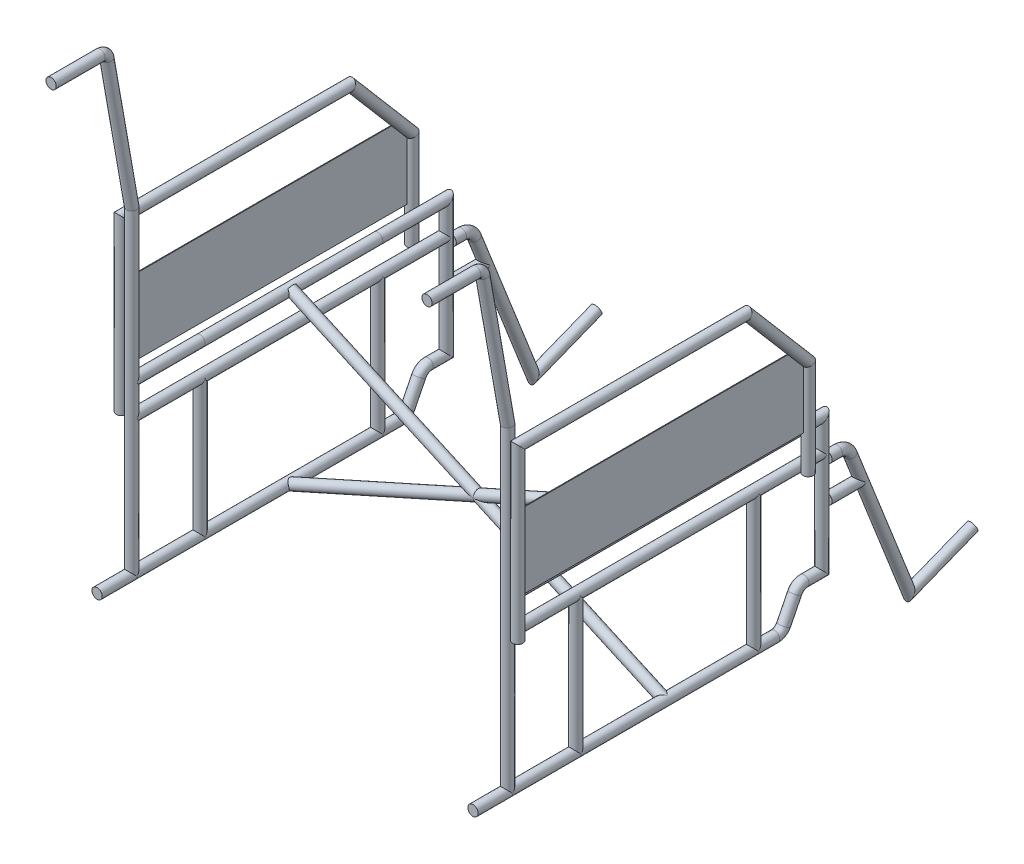
from build123d import *

# Parameters (mm, degrees)
VARREDURA1_PROFILE_R          = 7.5
RESSALTO_EXTRUS_O3_OUTLINE_R  = 7.537130279
RESSALTO_EXTRUS_O3_DEPTH      = 50.658102442
VARREDURA9_PROFILE_R          = 7.5
VARREDURA14_PROFILE_R         = 7.5
VARREDURA17_PROFILE_R         = 7.5
VARREDURA22_PROFILE_R         = 7.5
VARREDURA25_PROFILE_R         = 7.5
VARREDURA26_PROFILE_R         = 7.5
RESSALTO_EXTRUS_O5_DEPTH      = 0.55
RESSALTO_EXTRUS_O5_DEPTH_BACK = 0.55
VARREDURA27_PROFILE_R         = 7.5
VARREDURA28_PROFILE_R         = 7.5
VARREDURA29_PROFILE_R         = 7.5


with BuildPart() as part:
    # Varredura1: sweep along a path in Esboço1
    with BuildLine(Plane(origin=(0, 0, 0), x_dir=(0, 0, -1), z_dir=(1, 0, 0))) as varredura1_path:
        Line((0, 0), (100, 0))
        Line((100, 0), (360, 0))
        Line((360, 0), (390.738546016, 0))
        ThreePointArc((390.738546016, 0), (398.618936234, 2.236793114), (404.149086108, 8.280073331))
        Line((404.149086108, 8.280073331), (420.404466882, 40.719926669))
        ThreePointArc((420.404466882, 40.719926669), (425.934616757, 46.763206886), (433.815006974, 49))
        Line((433.815006974, 49), (460, 49))
        Line((460, 49), (460, 245))
        Line((460, 245), (360, 245))
        Line((360, 245), (100, 245))
        Line((100, 245), (0, 245))
        Line((0, 245), (0, 0))
    # Varredura1 profile (on start of the path) → Varredura1 (sweep)
    with BuildSketch(Plane(origin=(0, 0, 0), x_dir=(-1, 0, 0), z_dir=(0, 0, -1))):
        Circle(VARREDURA1_PROFILE_R)
    sweep(path=varredura1_path.line, transition=Transition.RIGHT)

    # Ressalto-extrusão3: read off the stored shape, not the designer's step
    # Ressalto-extrusão3 outline → Ressalto-extrusão3 (add)
    with BuildSketch(Plane.XY):
        Circle(RESSALTO_EXTRUS_O3_OUTLINE_R)
    extrude(amount=RESSALTO_EXTRUS_O3_DEPTH)

    # Varredura9: sweep along a path in Esboço6
    with BuildLine(Plane(origin=(0, 0, 0), x_dir=(0, 0, -1), z_dir=(1, 0, 0))) as varredura9_path:
        Line((100, 0), (100, 200.353309761))
    # Varredura9 profile (on start of the path) → Varredura9 (sweep)
    with BuildSketch(Plane(origin=(0, 0, -100), x_dir=(0, 0, 1), z_dir=(0, 1, 0))):
        Circle(VARREDURA9_PROFILE_R)
    sweep(path=varredura9_path.line)

    # Varredura14: sweep along a path in Esboço7
    with BuildLine(Plane(origin=(0, 0, 0), x_dir=(0, 0, -1), z_dir=(1, 0, 0))) as varredura14_path:
        Line((360, 0), (360, 200.014373302))
    # Varredura14 profile (on start of the path) → Varredura14 (sweep)
    with BuildSketch(Plane(origin=(0, 0, -360), x_dir=(0, 0, 1), z_dir=(0, 1, 0))):
        Circle(VARREDURA14_PROFILE_R)
    sweep(path=varredura14_path.line)

    # Varredura17: sweep along a path in Esboço242
    with BuildLine(Plane(origin=(0, 0, 0), x_dir=(0, 0, -1), z_dir=(1, 0, 0))) as varredura17_path:
        Line((0, 199.249020863), (459.296009098, 199.249020863))
    # Varredura17 profile (on start of the path) → Varredura17 (sweep)
    with BuildSketch(Plane(origin=(0, 199.249020863, 0), x_dir=(-1, 0, 0), z_dir=(0, 0, -1))):
        Circle(VARREDURA17_PROFILE_R)
    sweep(path=varredura17_path.line)

    # Varredura22: sweep along a path in Esboço279
    with BuildLine(Plane(origin=(0, 0, 0), x_dir=(0, 0, -1), z_dir=(1, 0, 0))) as varredura22_path:
        Line((0, 245), (0, 465))
        Line((0, 465), (-36.46611731, 671.809628133))
        ThreePointArc((-36.46611731, 671.809628133), (-39.886318743, 677.733590787), (-46.31419484, 680.073146356))
        Line((-46.31419484, 680.073146356), (-117.923198528, 680.073146356))
    # Varredura22 profile (on start of the path) → Varredura22 (sweep)
    with BuildSketch(Plane.ZX.offset(245)):
        Circle(VARREDURA22_PROFILE_R)
    sweep(path=varredura22_path.line, transition=Transition.RIGHT)


with BuildPart() as body_2:
    # Varredura25: sweep along a path in Esboço303
    with BuildLine(Plane(origin=(0, 0, 0), x_dir=(0, 0, -1), z_dir=(1, 0, 0))) as varredura25_path:
        Line((467.5, 136.031023838), (517.081565165, 136.031023838))
    # Varredura25 profile (on start of the path) → Varredura25 (sweep)
    with BuildSketch(Plane(origin=(0, 136.031023838, -467.5), x_dir=(-1, 0, 0), z_dir=(0, 0, -1))):
        Circle(VARREDURA25_PROFILE_R)
    sweep(path=varredura25_path.line)

    # Varredura27: sweep along a path in Esboço302
    with BuildLine(Plane(origin=(0, 0, 0), x_dir=(0, 0, -1), z_dir=(1, 0, 0))) as varredura27_path:
        Line((467.5, 189.005412816), (482.576251784, 189.005412816))
        ThreePointArc((482.576251784, 189.005412816), (493.828688215, 185.539700655), (501.181354069, 176.343680251))
        Line((501.181354069, 176.343680251), (587.405996433, -42.266271602))
        Line((587.405996433, -42.266271602), (680.43150786, -5.574934426))
    # Varredura27 profile (on start of the path) → Varredura27 (sweep)
    with BuildSketch(Plane(origin=(0, 189.005412816, -467.5), x_dir=(-1, 0, 0), z_dir=(0, 0, -1))):
        Circle(VARREDURA27_PROFILE_R)
    sweep(path=varredura27_path.line, transition=Transition.RIGHT)


with BuildPart() as body_3:
    # Varredura26: sweep along a path in Esboço294
    with BuildLine(Plane(origin=(15, 0, 0), x_dir=(0, 0, -1), z_dir=(1, 0, 0))) as varredura26_path:
        Line((424.987913504, 197.728542192), (424.987913504, 338.745926287))
        Line((424.987913504, 338.745926287), (334.34639884, 445))
        Line((334.34639884, 445), (0, 445))
        Line((0, 445), (0, 197.728542192))
    # Varredura26 profile (on start of the path) → Varredura26 (sweep)
    with BuildSketch(Plane(origin=(15, 197.728542192, -424.987913504), x_dir=(0, 0, 1), z_dir=(0, 1, 0))):
        Circle(VARREDURA26_PROFILE_R)
    sweep(path=varredura26_path.line, transition=Transition.RIGHT)


with BuildPart() as body_4:
    # Esboço325 → Ressalto-extrusão5 (new, two sides: drawn at the far end of the back side and taken through both)
    with BuildSketch(Plane(origin=(15, 0, 0), x_dir=(0, 0, -1), z_dir=(1, 0, 0)).offset(-RESSALTO_EXTRUS_O5_DEPTH_BACK)):
        Polygon((7.5, 362.571395037), (394.805064587, 362.571395037), (417.487913504, 335.981535967), (417.487913504, 251.998104881), (7.5, 252.5), align=None)
    extrude(amount=RESSALTO_EXTRUS_O5_DEPTH + RESSALTO_EXTRUS_O5_DEPTH_BACK)


with BuildPart() as body_5:
    # Corpo-Mover/Copiar1: read off the stored shape, not the designer's step
    # Corpo-Mover/Copiar1: copy of body 2
    add(body_2.part.moved(Location((-550, 0, 0))))


with BuildPart() as body_6:
    # Corpo-Mover_Copiar1 2: copy of part
    add(part.part.moved(Location((-550, 0, 0))))


with BuildPart() as part_1:
    add(part.part)

    add(body_6.part)  # Varredura28 merges body 6
    # Varredura28: sweep along a path in Esboço33
    with BuildLine(Plane.XY.offset(-230)) as varredura28_path:
        Line((0, 245.453414401), (-547.074890212, 0))
    # Varredura28 profile (on start of the path) → Varredura28 (sweep)
    with BuildSketch(Plane(origin=(0, 245.453414401, -230), x_dir=(0.40935159688576284, -0.9123767150289819, 0), z_dir=(-0.9123767150289819, -0.40935159688576284, 0))):
        Circle(VARREDURA28_PROFILE_R)
    sweep(path=varredura28_path.line)

    # Varredura29: sweep along a path in Esboço32
    with BuildLine(Plane.XY.offset(-230)) as varredura29_path:
        Line((0, 0), (-547.074890212, 246.861708637))
    # Varredura29 profile (on start of the path) → Varredura29 (sweep)
    with BuildSketch(Plane(origin=(0, 0, -230), x_dir=(-0.4113038774906765, -0.9114982832464001, 0), z_dir=(-0.9114982832464001, 0.4113038774906765, 0))):
        Circle(VARREDURA29_PROFILE_R)
    sweep(path=varredura29_path.line)


with BuildPart() as body_6_2:
    # Corpo-Mover/Copiar2: read off the stored shape, not the designer's step
    # Corpo-Mover/Copiar2: copy of body 4
    add(body_4.part.moved(Location((-580, 0, 0))))


with BuildPart() as body_7:
    # Corpo-Mover_Copiar2 2: copy of body 3
    add(body_3.part.moved(Location((-580, 0, 0))))


solid = Compound([body_2.part, body_3.part, body_4.part, body_5.part, part_1.part, body_6_2.part, body_7.part])
